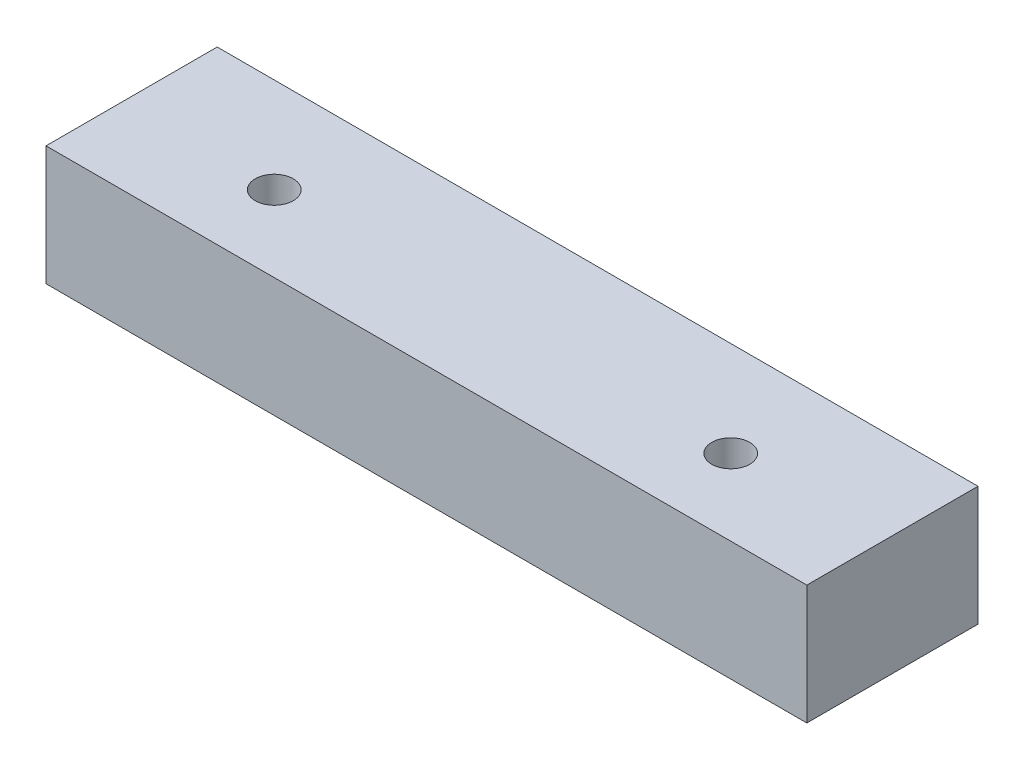
from build123d import *

# Parameters (mm, degrees)
SKETCH1_W               = 40
SKETCH1_H               = 9
BOSS_EXTRUDE1_DEPTH     = 6.28
CUT_EXTRUDE1_DEPTH      = 5
CUT_EXTRUDE1_DEPTH_BACK = 10
SKETCH2_R               = 1
SKETCH3_R               = 1.5
CUT_EXTRUDE6_DEPTH      = 3.8
SKETCH4_W               = 3
SKETCH4_H               = 0.5
CUT_EXTRUDE7_DEPTH      = 2.5


with BuildPart() as part:
    # Sketch1 → Boss-Extrude1 (new body)
    with BuildSketch(Plane(origin=(0, 0, 0), x_dir=(1, 0, 0), z_dir=(0, 1, 0))):
        with Locations((20, 4.5)):
            Rectangle(SKETCH1_W, SKETCH1_H)
    extrude(amount=BOSS_EXTRUDE1_DEPTH)

    # Sketch2 → Cut-Extrude1 (cut, two sides: drawn at the far end of the back side and taken through both)
    with BuildSketch(Plane(origin=(0, 6.28, 0), x_dir=(1, 0, 0), z_dir=(0, 1, 0)).offset(-CUT_EXTRUDE1_DEPTH_BACK)):
        with Locations((8, 4)):
            Circle(SKETCH2_R)
        with Locations((32, 4)):
            Circle(SKETCH2_R)
    extrude(amount=CUT_EXTRUDE1_DEPTH + CUT_EXTRUDE1_DEPTH_BACK, mode=Mode.SUBTRACT)

    # Sketch3 → Cut-Extrude6 (cut)
    with BuildSketch(Plane(origin=(0, 0, -9), x_dir=(-1, 0, 0), z_dir=(0, 0, -1))):
        with Locations((-32, 4.28)):
            Circle(SKETCH3_R)
        with Locations((-8, 4.28)):
            Circle(SKETCH3_R)
    extrude(amount=-CUT_EXTRUDE6_DEPTH, mode=Mode.SUBTRACT)

    # Sketch4 → Cut-Extrude7 (cut)
    with BuildSketch(Plane(origin=(0, 0, -5.2), x_dir=(-1, 0, 0), z_dir=(0, 0, -1))):
        with Locations((-32, 4.28)):
            Rectangle(SKETCH4_W, SKETCH4_H)
        with Locations((-8, 4.28)):
            Rectangle(SKETCH4_W, SKETCH4_H)
    extrude(amount=-CUT_EXTRUDE7_DEPTH, mode=Mode.SUBTRACT)


solid = part.part
